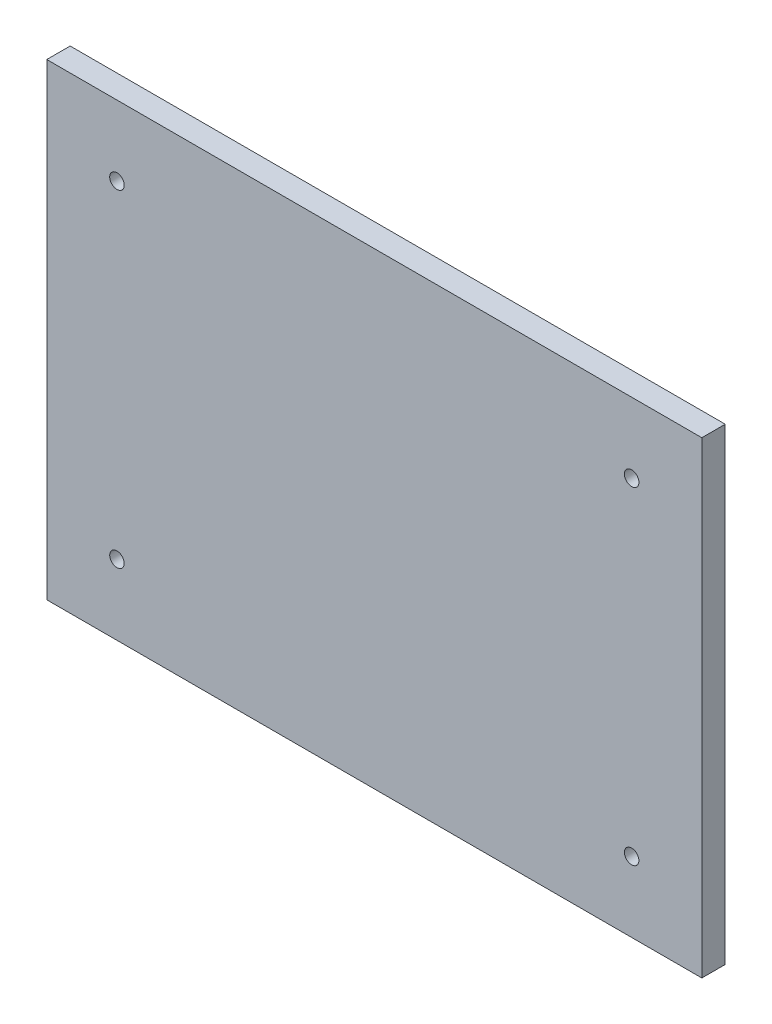
from build123d import *

# Parameters (mm, degrees)
ESQUISSE1_W        = 140
ESQUISSE1_H        = 100
ESQUISSE1_R        = 1.55
BOSS_EXTRU_1_DEPTH = 5


with BuildPart() as part:
    # Esquisse1 → Boss.-Extru.1 (new body)
    with BuildSketch(Plane.XY):
        Rectangle(ESQUISSE1_W, ESQUISSE1_H)
        with Locations((-55, -35)):
            Circle(ESQUISSE1_R, mode=Mode.SUBTRACT)
        with Locations((55, -35)):
            Circle(ESQUISSE1_R, mode=Mode.SUBTRACT)
        with Locations((55, 35)):
            Circle(ESQUISSE1_R, mode=Mode.SUBTRACT)
        with Locations((-55, 35)):
            Circle(ESQUISSE1_R, mode=Mode.SUBTRACT)
    extrude(amount=-BOSS_EXTRU_1_DEPTH)


solid = part.part
